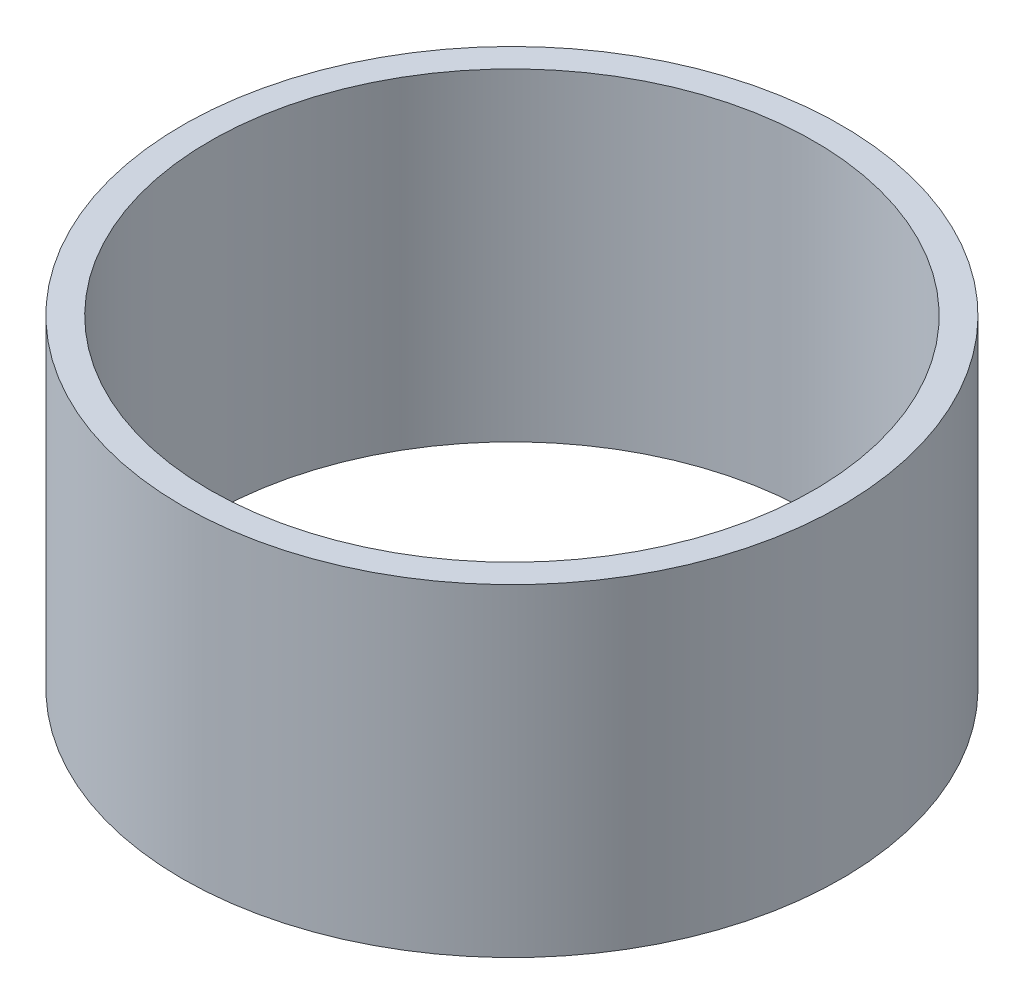
from build123d import *

# Parameters (mm, degrees)
SKETCH1_R           = 76.2
SKETCH1_R_2         = 69.85
BOSS_EXTRUDE1_DEPTH = 37.338


with BuildPart() as part:
    # Sketch1 → Boss-Extrude1 (new, symmetric)
    with BuildSketch(Plane(origin=(0, 0, 0), x_dir=(1, 0, 0), z_dir=(0, 1, 0))):
        Circle(SKETCH1_R)
        Circle(SKETCH1_R_2, mode=Mode.SUBTRACT)
    extrude(amount=BOSS_EXTRUDE1_DEPTH, both=True)


solid = part.part
